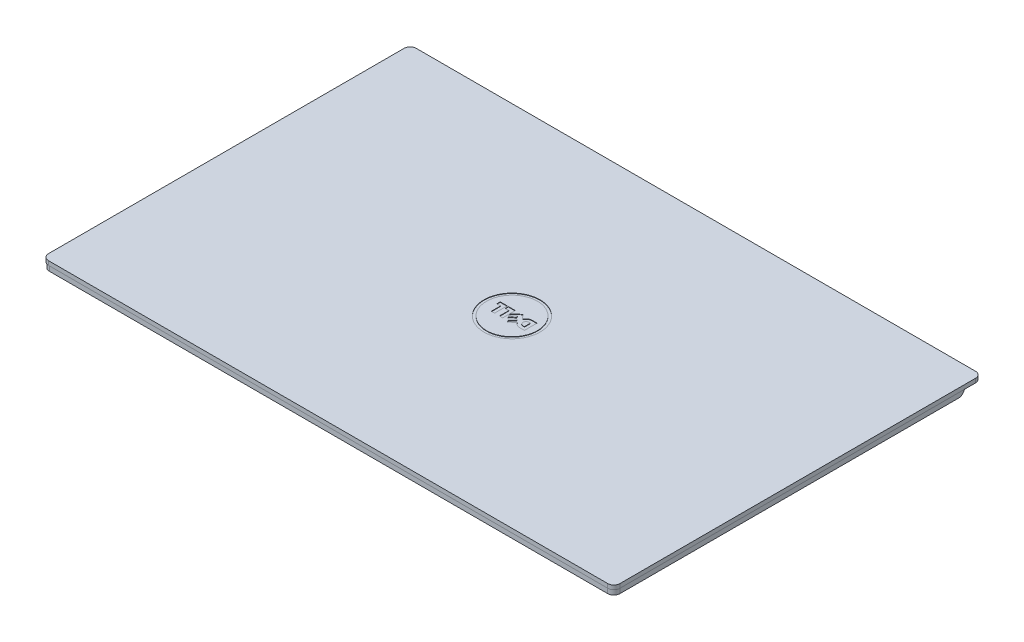
from build123d import *

# Parameters (mm, degrees)
SKETCH1_W           = 228.6762
SKETCH1_H           = 3.175
BOSS_EXTRUDE1_DEPTH = 355.6
SKETCH2_W           = 31.75
SKETCH2_H           = 10.16
CUT_EXTRUDE1_DEPTH  = 423.793383429
SKETCH3_W           = 345.44
SKETCH3_H           = 198.4375
CUT_EXTRUDE2_DEPTH  = 2.032
SKETCH4_W           = 345.44
SKETCH4_H           = 198.4375
BOSS_EXTRUDE2_DEPTH = 2.0066
BOSS_EXTRUDE3_DEPTH = 2.54
FILLET1_R           = 3.81
SKETCH7_R           = 17.4625
SKETCH7_R_2         = 15.875
CUT_EXTRUDE3_DEPTH  = 0.254
CUT_EXTRUDE4_DEPTH  = 0.254
SKETCH9_R           = 1.905
CUT_EXTRUDE5_DEPTH  = 0.254
BOSS_EXTRUDE4_START = 0.2286
SKETCH10_R          = 1.905
BOSS_EXTRUDE4_DEPTH = 0.2286
BOSS_EXTRUDE5_START = 0.2286
BOSS_EXTRUDE5_DEPTH = 0.2286
SKETCH13_R          = 1.905
BOSS_EXTRUDE6_DEPTH = 146.05
FILLET2_R           = 3.81


with BuildPart() as part:
    # Sketch1 → Boss-Extrude1 (new body)
    with BuildSketch(Plane(origin=(0, 0, 0), x_dir=(0, 0, -1), z_dir=(1, 0, 0))):
        with Locations((114.3381, 1.5875)):
            Rectangle(SKETCH1_W, SKETCH1_H)
    extrude(amount=BOSS_EXTRUDE1_DEPTH)

    # Sketch2 → Cut-Extrude1 (cut, through all)
    with BuildSketch(Plane(origin=(0, 0, 0), x_dir=(-1, 0, 0), z_dir=(0, -1, 0))):
        with Locations((-15.875, 223.5962)):
            Rectangle(SKETCH2_W, SKETCH2_H)
        with Locations((-339.725, 223.5962)):
            Rectangle(SKETCH2_W, SKETCH2_H)
    extrude(amount=-CUT_EXTRUDE1_DEPTH, mode=Mode.SUBTRACT)

    # Sketch3 → Cut-Extrude2 (cut)
    with BuildSketch(Plane.XZ):
        with Locations((177.8, -104.29875)):
            Rectangle(SKETCH3_W, SKETCH3_H)
    extrude(amount=-CUT_EXTRUDE2_DEPTH, mode=Mode.SUBTRACT)

    # Sketch4 → Boss-Extrude2 (add)
    with BuildSketch(Plane.XZ.offset(-2.032)):
        with Locations((177.8, -104.29875)):
            Rectangle(SKETCH4_W, SKETCH4_H)
    extrude(amount=BOSS_EXTRUDE2_DEPTH)

    # Sketch6 → Boss-Extrude3 (add)
    with BuildSketch(Plane(origin=(0, 3.175, 0), x_dir=(1, 0, 0), z_dir=(0, 1, 0))):
        Polygon((-0.254, 218.5162), (-0.254, 228.9302), (355.854, 228.9302), (355.854, 218.5162), (355.854, -0.254), (-0.254, -0.254), align=None)
    extrude(amount=BOSS_EXTRUDE3_DEPTH)

    # Fillet1
    fillet1_edges = [part.edges().sort_by_distance(p)[0] for p in [
        (355.6, 1.5875, 0),
        (0, 1.5875, 0),
        (355.854, 4.445, -228.9302),
        (-0.254, 4.445, -228.9302),
        (-0.254, 4.445, 0.254),
        (355.854, 4.445, 0.254),
    ]]
    fillet(fillet1_edges, radius=FILLET1_R)

    # Sketch7 → Cut-Extrude3 (cut)
    with BuildSketch(Plane(origin=(0, 5.715, 0), x_dir=(1, 0, 0), z_dir=(0, 1, 0))):
        with Locations(Location((177.8, 114.3381, 0), (0, 0, 270))):
            Circle(SKETCH7_R)
        with Locations(Location((177.8, 114.3381, 0), (0, 0, 270))):
            Circle(SKETCH7_R_2, mode=Mode.SUBTRACT)
    extrude(amount=-CUT_EXTRUDE3_DEPTH, mode=Mode.SUBTRACT)

    # Sketch8 → Cut-Extrude4 (cut)
    # profile 1 of 2: a face of its own
    with BuildSketch(Plane(origin=(0, 5.715, 0), x_dir=(1, 0, 0), z_dir=(0, 1, 0))):
        with BuildLine():
            Line((189.471398708, 110.4011), (186.550398708, 110.4011))
            ThreePointArc((186.550398708, 110.4011), (184.504960684, 110.974151087), (183.054971216, 112.52648314))
            Line((183.054971216, 112.52648314), (179.786995785, 109.664107496))
            Line((179.786995785, 109.664107496), (178.860958774, 110.721364327))
            Line((178.860958774, 110.721364327), (181.805633989, 113.300565668))
            Line((181.805633989, 113.300565668), (181.102738426, 114.103061816))
            Line((181.102738426, 114.103061816), (178.158063211, 111.523860475))
            Line((178.158063211, 111.523860475), (177.2320262, 112.581117305))
            Line((177.2320262, 112.581117305), (180.176701415, 115.160318646))
            Line((180.176701415, 115.160318646), (179.473805853, 115.962814795))
            Line((179.473805853, 115.962814795), (176.529130638, 113.383613454))
            Line((176.529130638, 113.383613454), (175.943285209, 114.052473416))
            Line((175.943285209, 114.052473416), (175.943285209, 110.4011))
            Line((175.943285209, 110.4011), (173.911285209, 110.4011))
            Line((173.911285209, 110.4011), (173.911285209, 116.2431))
            Line((173.911285209, 116.2431), (171.625285209, 116.2431))
            Line((171.625285209, 116.2431), (171.625285209, 118.2751))
            Line((171.625285209, 118.2751), (175.943285209, 118.2751))
            Line((175.943285209, 118.2751), (175.943285209, 114.738839507))
            Line((175.943285209, 114.738839507), (180.379856415, 118.624772442))
            Line((180.379856415, 118.624772442), (182.882189217, 115.767858068))
            ThreePointArc((182.882189217, 115.767858068), (184.328798892, 117.588402025), (186.550398708, 118.2751))
            Line((186.550398708, 118.2751), (189.471398708, 118.2751))
            Line((189.471398708, 118.2751), (189.471398708, 110.4011))
        make_face()
        with BuildLine():
            Line((187.439398708, 112.4331), (187.439398708, 116.2431))
            Line((187.439398708, 116.2431), (186.550398708, 116.2431))
            ThreePointArc((186.550398708, 116.2431), (184.645398708, 114.3381), (186.550398708, 112.4331))
            Line((186.550398708, 112.4331), (187.439398708, 112.4331))
        make_face(mode=Mode.SUBTRACT)
    # profile 2 of 2: a face of its own
    with BuildSketch(Plane(origin=(0, 5.715, 0), x_dir=(1, 0, 0), z_dir=(0, 1, 0))):
        Polygon((168.831285209, 116.2431), (168.831285209, 110.4011), (170.863285209, 110.4011), (170.863285209, 118.2751), (166.545285209, 118.2751), (166.545285209, 116.2431), align=None)
    extrude(amount=-CUT_EXTRUDE4_DEPTH, mode=Mode.SUBTRACT)

    # Sketch9 → Cut-Extrude5 (cut)
    # profile 1 of 3: a face of its own
    with BuildSketch(Plane.XZ):
        with Locations(Location((96.52, -212.4075, 0), (0, 0, 270))):
            Circle(SKETCH9_R)
    # profile 2 of 3: a face of its own
    with BuildSketch(Plane.XZ):
        with BuildLine():
            Line((163.597466716, -204.7875), (163.597466716, -214.4395))
            Line((163.597466716, -214.4395), (167.153466716, -214.4395))
            ThreePointArc((167.153466716, -214.4395), (169.995954467, -213.513569152), (171.747705751, -211.091080351))
            Line((171.747705751, -211.091080351), (177.435092391, -215.322094253))
            Line((177.435092391, -215.322094253), (181.43588491, -209.94417434))
            Line((181.43588491, -209.94417434), (181.43588491, -214.4395))
            Line((181.43588491, -214.4395), (187.023578862, -214.4395))
            Line((187.023578862, -214.4395), (187.023578862, -211.885215882))
            Line((187.023578862, -211.885215882), (184.074788764, -211.885215882))
            Line((184.074788764, -211.885215882), (184.074788764, -204.7875))
            Line((184.074788764, -204.7875), (181.43588491, -204.7875))
            Line((181.43588491, -204.7875), (181.43588491, -209.234781788))
            Line((181.43588491, -209.234781788), (180.463746146, -208.51157922))
            Line((180.463746146, -208.51157922), (177.292916042, -212.773852326))
            Line((177.292916042, -212.773852326), (176.395981379, -212.106596296))
            Line((176.395981379, -212.106596296), (179.566811483, -207.84432319))
            Line((179.566811483, -207.84432319), (178.117732485, -206.766310779))
            Line((178.117732485, -206.766310779), (174.946902382, -211.028583886))
            Line((174.946902382, -211.028583886), (174.049967719, -210.361327856))
            Line((174.049967719, -210.361327856), (177.220797822, -206.099054749))
            Line((177.220797822, -206.099054749), (175.771718825, -205.021042339))
            Line((175.771718825, -205.021042339), (171.948374325, -210.160434204))
            ThreePointArc((171.948374325, -210.160434204), (170.754145851, -206.400186171), (167.153466716, -204.7875))
            Line((167.153466716, -204.7875), (163.597466716, -204.7875))
        make_face()
        with BuildLine():
            Line((166.391466716, -211.6455), (167.153466716, -211.6455))
            ThreePointArc((167.153466716, -211.6455), (169.185466716, -209.6135), (167.153466716, -207.5815))
            Line((167.153466716, -207.5815), (166.391466716, -207.5815))
            Line((166.391466716, -207.5815), (166.391466716, -211.6455))
        make_face(mode=Mode.SUBTRACT)
    # profile 3 of 3: a face of its own
    with BuildSketch(Plane.XZ):
        Polygon((190.678788764, -204.7875), (188.03988491, -204.7875), (188.03988491, -209.234781788), (188.03988491, -209.94417434), (188.03988491, -214.4395), (193.627578862, -214.4395), (193.627578862, -211.885215882), (190.678788764, -211.885215882), align=None)
    extrude(amount=-CUT_EXTRUDE5_DEPTH, mode=Mode.SUBTRACT)

    # Sketch10 → Boss-Extrude4 (add)
    with BuildSketch(Plane.XZ.offset(-0.254).offset(BOSS_EXTRUDE4_START)):
        with Locations(Location((96.52, -212.4075, 0), (0, 0, 270))):
            Circle(SKETCH10_R)
    extrude(amount=-BOSS_EXTRUDE4_DEPTH)

    # Sketch12 → Boss-Extrude5 (add)
    with BuildSketch(Plane.XZ.offset(-0.254).offset(BOSS_EXTRUDE5_START)):
        Polygon((188.03988491, -204.7875), (188.03988491, -214.4395), (193.627578862, -214.4395), (193.627578862, -211.885215882), (190.678788764, -211.885215882), (190.678788764, -204.7875), align=None)
        with BuildLine():
            Line((167.153466716, -204.7875), (163.597466716, -204.7875))
            Line((163.597466716, -204.7875), (163.597466716, -214.4395))
            Line((163.597466716, -214.4395), (167.153466716, -214.4395))
            ThreePointArc((167.153466716, -214.4395), (169.995954467, -213.513569152), (171.747705751, -211.091080351))
            Line((171.747705751, -211.091080351), (177.435092391, -215.322094253))
            Line((177.435092391, -215.322094253), (181.43588491, -209.94417434))
            Line((181.43588491, -209.94417434), (181.43588491, -214.4395))
            Line((181.43588491, -214.4395), (187.023578862, -214.4395))
            Line((187.023578862, -214.4395), (187.023578862, -211.885215882))
            Line((187.023578862, -211.885215882), (184.074788764, -211.885215882))
            Line((184.074788764, -211.885215882), (184.074788764, -204.7875))
            Line((184.074788764, -204.7875), (181.43588491, -204.7875))
            Line((181.43588491, -204.7875), (181.43588491, -209.234781788))
            Line((181.43588491, -209.234781788), (180.463746146, -208.51157922))
            Line((180.463746146, -208.51157922), (177.292916042, -212.773852326))
            Line((177.292916042, -212.773852326), (176.395981379, -212.106596296))
            Line((176.395981379, -212.106596296), (179.566811483, -207.84432319))
            Line((179.566811483, -207.84432319), (178.117732485, -206.766310779))
            Line((178.117732485, -206.766310779), (174.946902382, -211.028583886))
            Line((174.946902382, -211.028583886), (174.049967719, -210.361327856))
            Line((174.049967719, -210.361327856), (177.220797822, -206.099054749))
            Line((177.220797822, -206.099054749), (175.771718825, -205.021042339))
            Line((175.771718825, -205.021042339), (171.948374325, -210.160434204))
            ThreePointArc((171.948374325, -210.160434204), (170.754145851, -206.400186171), (167.153466716, -204.7875))
        make_face()
    extrude(amount=-BOSS_EXTRUDE5_DEPTH)

    # Sketch13 → Boss-Extrude6 (add, symmetric)
    with BuildSketch(Plane.ZY.offset(-177.8)):
        with BuildLine():
            Line((-227.129067699, -5.461), (-227.129067699, 0))
            Line((-227.129067699, 0), (-220.144067699, 0))
            Line((-220.144067699, 0), (-220.144067699, -5.461))
            ThreePointArc((-220.144067699, -5.461), (-223.636567699, -8.9535), (-227.129067699, -5.461))
        make_face()
        with Locations((-223.5962, -5.08)):
            Circle(SKETCH13_R, mode=Mode.SUBTRACT)
    extrude(amount=BOSS_EXTRUDE6_DEPTH, both=True)

    # Fillet2
    # the kernel refuses this fillet: 3.81 mm, written as the material it takes off along each edge
    with BuildSketch(Plane(origin=(364.991776656, 0, -218.5162), x_dir=(0, 1, 0), z_dir=(-1, 0, 0))) as fillet2_piece_1:
        with BuildLine():
            CenterArc((3.81, -3.756710662), FILLET2_R, 99.594068227, 80.405931773)
            Line((0, -3.756710662), (-0.0762, -3.756710662))
            Line((-0.0762, -3.756710662), (-0.0762, 0))
            Line((-0.0762, 0), (0, 0.0762))
            ThreePointArc((0, 0.0762), (1.5875, 0.0762), (3.1623, 0.075134213))
            Line((3.1623, 0.075134213), (3.175, 0))
        make_face()
    extrude(amount=41.141776656, mode=Mode.SUBTRACT)
    with BuildSketch(Plane(origin=(-9.391776656, 0, -218.5162), x_dir=(0, 1, 0), z_dir=(1, 0, 0))) as fillet2_piece_2:
        with BuildLine():
            CenterArc((3.81, 3.756710662), FILLET2_R, 180, 80.405931773)
            Line((0, 3.756710662), (-0.0762, 3.756710662))
            Line((-0.0762, 3.756710662), (-0.0762, 0))
            Line((-0.0762, 0), (0, -0.0762))
            ThreePointArc((0, -0.0762), (1.5875, -0.0762), (3.1623, -0.075134213))
            Line((3.1623, -0.075134213), (3.175, 0))
        make_face()
    extrude(amount=41.141776656, mode=Mode.SUBTRACT)


solid = part.part
